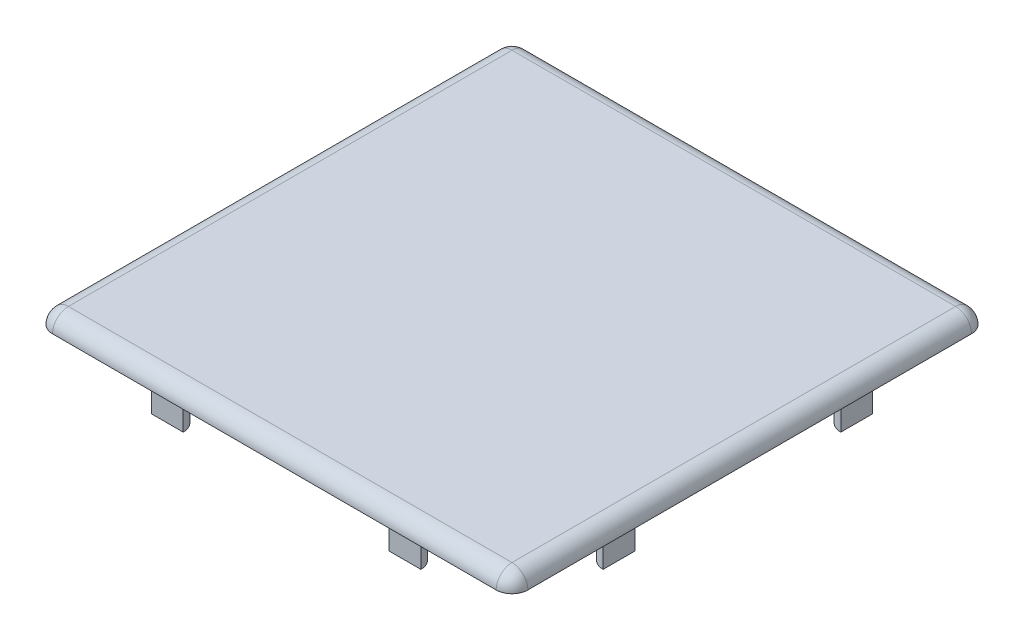
from build123d import *

# Parameters (mm, degrees)
SKETCH_1_W            = 60
SKETCH_1_H            = 60
EXTRUDE_1_DEPTH       = 2
EXTRUDE_2_DEPTH       = 4
MIRROR_2_COPY_1_DEPTH = 4
EXTRUDE_3_DEPTH       = 4
MIRROR_4_COPY_1_DEPTH = 4
FILLET_1_R            = 2


with BuildPart() as part:
    # 草图1 → 凸台-拉伸1 (new body)
    with BuildSketch(Plane(origin=(0, 0, 0), x_dir=(1, 0, 0), z_dir=(0, 1, 0))):
        Rectangle(SKETCH_1_W, SKETCH_1_H)
    extrude(amount=EXTRUDE_1_DEPTH)

    # 草图2 → 凸台-拉伸2 (add)
    with BuildSketch(Plane.XZ):
        with BuildLine():
            Line((-28.5, 13), (-28.5, 17))
            ThreePointArc((-28.5, 17), (-26.5, 15), (-28.5, 13))
        make_face()
    extrude_2 = extrude(amount=EXTRUDE_2_DEPTH)

    # 镜向1: 凸台-拉伸2 across plane
    add(extrude_2.mirror(Plane.XY))

    # 镜向2: 凸台-拉伸2 across plane
    add(extrude_2.mirror(Plane(origin=(0, 0, 0), x_dir=(0, 0, 1), z_dir=(1, 0, 0))))

    # 镜向2 copy 1 sketch → 镜向2 copy 1 (add)
    with BuildSketch(Plane(origin=(0, 0, 0), x_dir=(-1, 0, 0), z_dir=(0, -1, 0))):
        with BuildLine():
            Line((-28.5, 13), (-28.5, 17))
            ThreePointArc((-28.5, 17), (-26.5, 15), (-28.5, 13))
        make_face()
    extrude(amount=MIRROR_2_COPY_1_DEPTH)

    # 草图3 → 凸台-拉伸3 (add)
    with BuildSketch(Plane.XZ):
        with BuildLine():
            Line((-13, 28.5), (-17, 28.5))
            ThreePointArc((-17, 28.5), (-15, 26.5), (-13, 28.5))
        make_face()
    extrude_3 = extrude(amount=EXTRUDE_3_DEPTH)

    # 镜向3: 凸台-拉伸3 across plane
    add(extrude_3.mirror(Plane(origin=(0, 0, 0), x_dir=(0, 0, 1), z_dir=(1, 0, 0))))

    # 镜向4: 凸台-拉伸3 across plane
    add(extrude_3.mirror(Plane.XY))

    # 镜向4 copy 1 sketch → 镜向4 copy 1 (add)
    with BuildSketch(Plane(origin=(0, 0, 0), x_dir=(-1, 0, 0), z_dir=(0, -1, 0))):
        with BuildLine():
            Line((-13, 28.5), (-17, 28.5))
            ThreePointArc((-17, 28.5), (-15, 26.5), (-13, 28.5))
        make_face()
    extrude(amount=MIRROR_4_COPY_1_DEPTH)

    # 圆角1
    fillet_1_edges = [part.edges().sort_by_distance(p)[0] for p in [
        (0, 2, 30),
        (30, 2, 0),
        (0, 2, -30),
        (-30, 2, 0),
        (30, 1, -30),
        (30, 1, 30),
        (-30, 1, 30),
        (-30, 1, -30),
    ]]
    fillet(fillet_1_edges, radius=FILLET_1_R - 0.0001)  # a hair under: the kernel refuses the full size


solid = part.part
